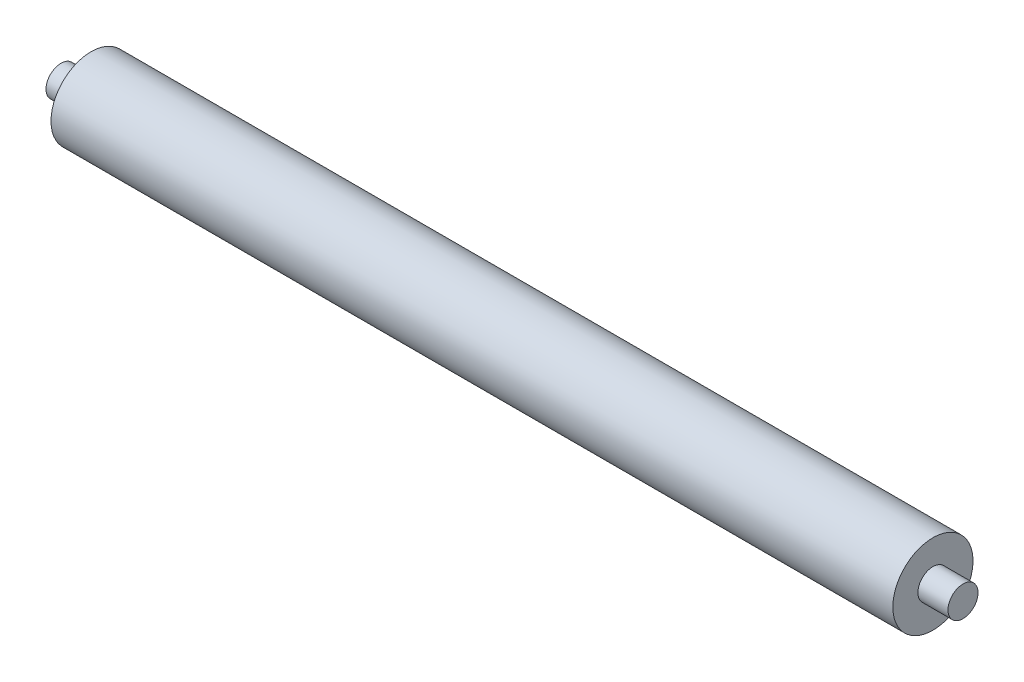
from build123d import *


with BuildPart() as part:
    # Esquisse1 → Révolution1 (revolve)
    with BuildSketch(Plane.XY):
        Polygon((0, 0), (90, 0), (90, 1.5), (87, 1.5), (87, 4), (3, 4), (3, 1.5), (0, 1.5), align=None)
    revolve(axis=Axis((0, 0, 0), (1, 0, 0)))


solid = part.part
